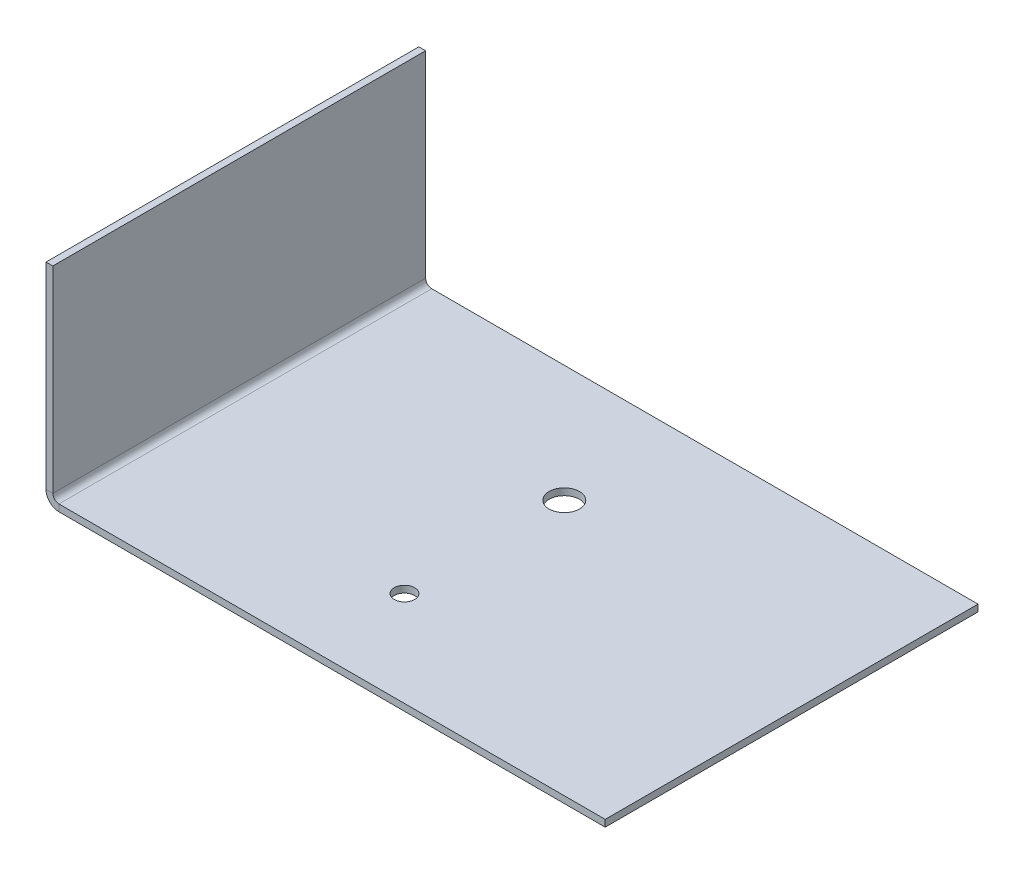
from build123d import *

# Parameters (mm, degrees)
SKETCH1_W                    = 152.4
SKETCH1_H                    = 101.6
BASE_FLANGE1_DEPTH           = 1.8542
EDGE_FLANGE1_STRIP_W         = 10.7442
EDGE_FLANGE1_STRIP_H         = 1.8542
EDGE_FLANGE1_STRIP_CUT_DEPTH = 101.6
EDGE_FLANGE1_DEPTH           = 101.6
SKETCH14_R                   = 2.7813
TAP_1_4_20_HOLE1_DEPTH       = 2.54
SKETCH15_R                   = 4.1413765
TAPPED_3_8_16_HOLE2_DEPTH    = 2.54


# Sheet-metal steps are written as plain solids
with BuildPart() as part:
    # Sketch1 → Base-Flange1 (new body)
    with BuildSketch(Plane(origin=(0, 0, 0), x_dir=(1, 0, 0), z_dir=(0, 1, 0))):
        with Locations((76.2, 50.8)):
            Rectangle(SKETCH1_W, SKETCH1_H)
    extrude(amount=-BASE_FLANGE1_DEPTH)

    # Edge-Flange1 strip (across the edge) → Edge-Flange1 strip cut (cut)
    with BuildSketch(Plane.XY.offset(-101.6)):
        with Locations((-1.8542, -0.9271)):
            Rectangle(EDGE_FLANGE1_STRIP_W, EDGE_FLANGE1_STRIP_H)
    extrude(amount=EDGE_FLANGE1_STRIP_CUT_DEPTH, mode=Mode.SUBTRACT)

    # Edge-Flange1 section (across the edge) → Edge-Flange1 (add)
    with BuildSketch(Plane.XY.offset(-101.6)):
        with BuildLine():
            Line((0, 1.6637), (0, 55.3339))
            Line((0, 55.3339), (1.8542, 55.3339))
            Line((1.8542, 55.3339), (1.8542, 1.6637))
            ThreePointArc((1.8542, 1.6637), (2.341486448, 0.487286448), (3.5179, 0))
            Line((3.5179, 0), (3.5179, -1.8542))
            ThreePointArc((3.5179, -1.8542), (1.030369054, -0.823830946), (0, 1.6637))
        make_face()
    extrude(amount=EDGE_FLANGE1_DEPTH)

    # Sketch14 → TAP 1/4-20 Hole1 (cut)
    with BuildSketch(Plane(origin=(0, 0, 0), x_dir=(1, 0, 0), z_dir=(0, 1, 0))):
        with Locations(Location((71.763910774, 25.92775269, 0), (0, 0, 270))):
            Circle(SKETCH14_R)
    extrude(amount=-TAP_1_4_20_HOLE1_DEPTH, mode=Mode.SUBTRACT)

    # Sketch15 → TAPPED 3/8-16 Hole2 (cut)
    with BuildSketch(Plane(origin=(0, 0, 0), x_dir=(1, 0, 0), z_dir=(0, 1, 0))):
        with Locations(Location((71.515516592, 69.738450307, 0), (0, 0, 270))):
            Circle(SKETCH15_R)
    extrude(amount=-TAPPED_3_8_16_HOLE2_DEPTH, mode=Mode.SUBTRACT)


solid = part.part
